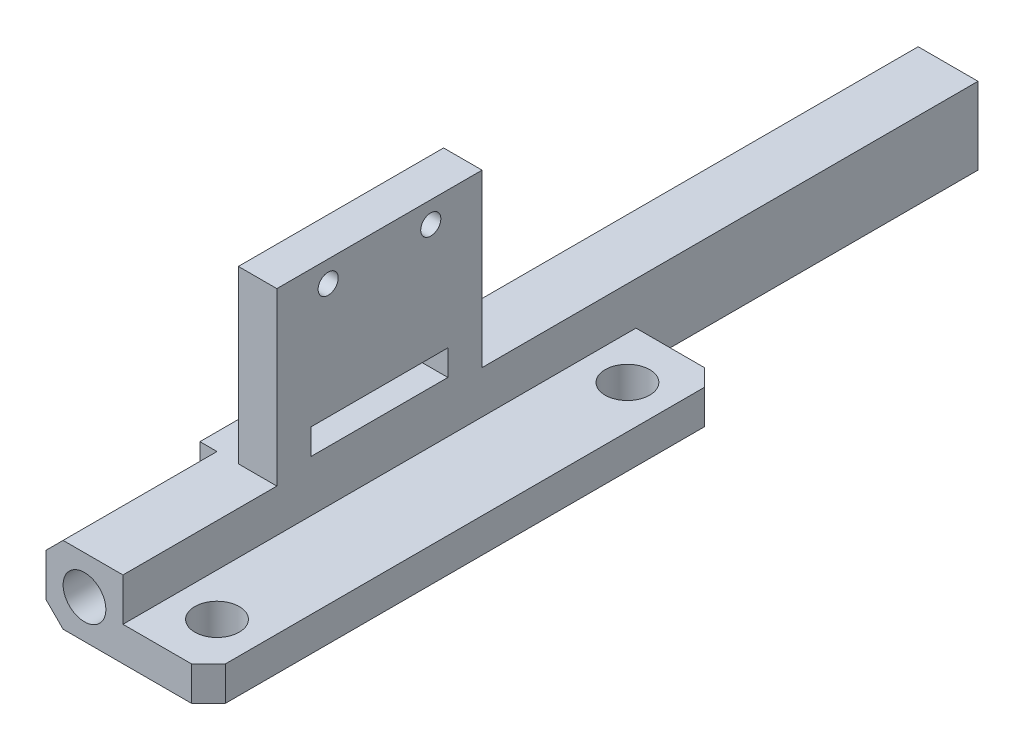
from build123d import *

# Parameters (mm, degrees)
SKETCH1_W           = 77.47
SKETCH1_H           = 127
BOSS_EXTRUDE1_DEPTH = 11.43
SKETCH2_R           = 3.175
CUT_EXTRUDE1_DEPTH  = 150.202030147
CUT_EXTRUDE2_DEPTH  = 150.202030147
SKETCH4_W           = 54.61
SKETCH4_H           = 6.35
CUT_EXTRUDE3_DEPTH  = 150.202030147
CHAMFER1_SIZE       = 2.54
CUT_EXTRUDE4_DEPTH  = 150.202030147
SKETCH6_W           = 53.34
SKETCH6_H           = 76.2
CUT_EXTRUDE5_DEPTH  = 150.202030147
SKETCH7_R           = 3.302
CUT_EXTRUDE6_DEPTH  = 130.427892666
CHAMFER2_SIZE       = 2.54
BOSS_EXTRUDE3_DEPTH = 15.24
CUT_EXTRUDE9_REACH  = 115.066
SKETCH13_W          = 5.715
SKETCH13_H          = 25.4
CUT_EXTRUDE10_REACH = 135.509
SKETCH14_R          = 1.492840828
SKETCH14_W          = 20.32
SKETCH14_H          = 3.81


with BuildPart() as part:
    # Sketch1 → Boss-Extrude1 (new body)
    with BuildSketch(Plane(origin=(0, 0, 0), x_dir=(1, 0, 0), z_dir=(0, 1, 0))):
        with Locations((38.735, 63.5)):
            Rectangle(SKETCH1_W, SKETCH1_H)
    extrude(amount=BOSS_EXTRUDE1_DEPTH)

    # Sketch2 → Cut-Extrude1 (cut, through all)
    with BuildSketch(Plane.XY):
        with Locations((5.715, 5.715)):
            Circle(SKETCH2_R)
        with Locations((71.755, 5.715)):
            Circle(SKETCH2_R)
    extrude(amount=-CUT_EXTRUDE1_DEPTH, mode=Mode.SUBTRACT)

    # Sketch3 → Cut-Extrude2 (cut, through all)
    with BuildSketch(Plane(origin=(0, 11.43, 0), x_dir=(1, 0, 0), z_dir=(0, 1, 0))):
        with BuildLine():
            Line((11.43, 127), (11.43, 88.9))
            ThreePointArc((11.43, 88.9), (15.149743879, 79.919743879), (24.13, 76.2))
            Line((24.13, 76.2), (53.34, 76.2))
            ThreePointArc((53.34, 76.2), (62.320256121, 79.919743879), (66.04, 88.9))
            Line((66.04, 88.9), (66.04, 127))
            Line((66.04, 127), (11.43, 127))
        make_face()
    extrude(amount=-CUT_EXTRUDE2_DEPTH, mode=Mode.SUBTRACT)

    # Sketch4 → Cut-Extrude3 (cut, through all)
    with BuildSketch(Plane(origin=(0, 0, -127), x_dir=(-1, 0, 0), z_dir=(0, 0, -1))):
        with Locations((-38.735, 8.255)):
            Rectangle(SKETCH4_W, SKETCH4_H)
    extrude(amount=-CUT_EXTRUDE3_DEPTH, mode=Mode.SUBTRACT)

    # Chamfer1
    chamfer1_edges = [part.edges().sort_by_distance(p)[0] for p in [
        (0, 0, -63.5),
        (0, 11.43, -63.5),
        (77.47, 0, -63.5),
        (77.47, 11.43, -63.5),
    ]]
    chamfer(chamfer1_edges, length=CHAMFER1_SIZE)

    # Sketch5 → Cut-Extrude4 (cut, through all)
    with BuildSketch(Plane(origin=(0, 11.43, 0), x_dir=(1, 0, 0), z_dir=(0, 1, 0))):
        Polygon((11.43, 88.9), (11.43, 76.2), (77.47, 76.2), (77.47, 127), (11.43, 127), align=None)
    extrude(amount=-CUT_EXTRUDE4_DEPTH, mode=Mode.SUBTRACT)

    # Sketch6 → Cut-Extrude5 (cut, through all)
    with BuildSketch(Plane(origin=(0, 11.43, 0), x_dir=(1, 0, 0), z_dir=(0, 1, 0))):
        with Locations((50.8, 38.1)):
            Rectangle(SKETCH6_W, SKETCH6_H)
    extrude(amount=-CUT_EXTRUDE5_DEPTH, mode=Mode.SUBTRACT)

    # Sketch7 → Cut-Extrude6 (cut, through all)
    with BuildSketch(Plane(origin=(0, 5.08, 0), x_dir=(1, 0, 0), z_dir=(0, 1, 0))):
        with Locations((17.78, 68.58)):
            Circle(SKETCH7_R)
        with Locations((17.78, 7.62)):
            Circle(SKETCH7_R)
    extrude(amount=-CUT_EXTRUDE6_DEPTH, mode=Mode.SUBTRACT)

    # Chamfer2
    chamfer2_edges = [part.edges().sort_by_distance(p)[0] for p in [
        (24.13, 2.54, -76.2),
        (24.13, 2.54, 0),
    ]]
    chamfer(chamfer2_edges, length=CHAMFER2_SIZE)

    # Sketch12 → Boss-Extrude3 (add)
    with BuildSketch(Plane.XY.offset(-38.1)):
        Polygon((0, 8.89), (0, 36.83), (11.43, 36.83), (11.43, 11.43), (2.54, 11.43), align=None)
    boss_extrude3 = extrude(amount=BOSS_EXTRUDE3_DEPTH)

    # Mirror1: Boss-Extrude3 across plane
    add(boss_extrude3.mirror(Plane.XY.offset(-38.1)))

    # Sketch13 → Cut-Extrude9 (cut, up to next)
    with BuildSketch(Plane.XY.offset(-22.86), mode=Mode.PRIVATE) as cut_extrude9_sk1:
        with Locations((2.8575, 24.13)):
            Rectangle(SKETCH13_W, SKETCH13_H)
    cut_extrude9_tool1 = extrude(cut_extrude9_sk1.sketch, amount=-CUT_EXTRUDE9_REACH, mode=Mode.PRIVATE) & part.part
    add(cut_extrude9_tool1.solids().sort_by_distance((2.8575, 24.13, -22.86))[0], mode=Mode.SUBTRACT)

    # Sketch14 → Cut-Extrude10 (cut, up to next)
    with BuildSketch(Plane.ZY.offset(-5.715), mode=Mode.PRIVATE) as cut_extrude10_sk1:
        with Locations((-45.72, 33.655)):
            Circle(SKETCH14_R)
    cut_extrude10_tool1 = extrude(cut_extrude10_sk1.sketch, amount=-CUT_EXTRUDE10_REACH, mode=Mode.PRIVATE) & part.part
    # Sketch14 → Cut-Extrude10 (cut, up to next)
    with BuildSketch(Plane.ZY.offset(-5.715), mode=Mode.PRIVATE) as cut_extrude10_sk2:
        with Locations((-30.48, 33.655)):
            Circle(SKETCH14_R)
    cut_extrude10_tool2 = extrude(cut_extrude10_sk2.sketch, amount=-CUT_EXTRUDE10_REACH, mode=Mode.PRIVATE) & part.part
    # Sketch14 → Cut-Extrude10 (cut, up to next)
    with BuildSketch(Plane.ZY.offset(-5.715), mode=Mode.PRIVATE) as cut_extrude10_sk3:
        with Locations((-38.1, 14.605)):
            Rectangle(SKETCH14_W, SKETCH14_H)
    cut_extrude10_tool3 = extrude(cut_extrude10_sk3.sketch, amount=-CUT_EXTRUDE10_REACH, mode=Mode.PRIVATE) & part.part
    add(cut_extrude10_tool1.solids().sort_by_distance((5.715, 33.655, -45.72))[0], mode=Mode.SUBTRACT)
    add(cut_extrude10_tool2.solids().sort_by_distance((5.715, 33.655, -30.48))[0], mode=Mode.SUBTRACT)
    add(cut_extrude10_tool3.solids().sort_by_distance((5.715, 14.605, -38.1))[0], mode=Mode.SUBTRACT)


solid = part.part
